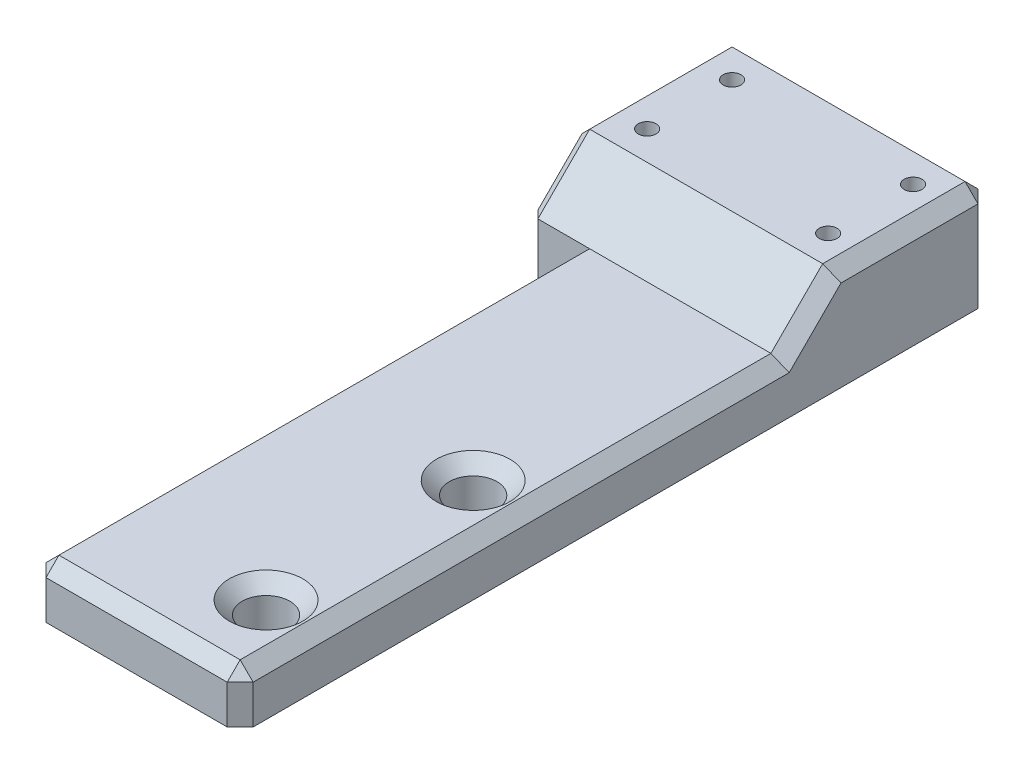
from build123d import *

# Parameters (mm, degrees)
SKETCH1_W           = 31.75
SKETCH1_H           = 92.075
SKETCH1_R           = 2.921
BOSS_EXTRUDE1_DEPTH = 12.7
SKETCH2_W           = 66.675
SKETCH2_H           = 6.35
CUT_EXTRUDE1_DEPTH  = 99.219947694
SKETCH3_R           = 1.0922
SKETCH3_W           = 6.35
SKETCH3_H           = 66.675
CUT_EXTRUDE2_DEPTH  = 99.219947694
CHAMFER1_SIZE       = 6.35
CHAMFER2_SIZE       = 1.5875


with BuildPart() as part:
    # Sketch1 → Boss-Extrude1 (new body)
    with BuildSketch(Plane(origin=(0, 0, 0), x_dir=(1, 0, 0), z_dir=(0, 1, 0))):
        with Locations((15.875, 46.0375)):
            Rectangle(SKETCH1_W, SKETCH1_H)
        with Locations((25.4, 9.525)):
            Circle(SKETCH1_R, mode=Mode.SUBTRACT)
        with Locations((25.4, 34.925)):
            Circle(SKETCH1_R, mode=Mode.SUBTRACT)
    extrude(amount=BOSS_EXTRUDE1_DEPTH)

    # Sketch2 → Cut-Extrude1 (cut, through all)
    with BuildSketch(Plane(origin=(31.75, 0, 0), x_dir=(0, 0, -1), z_dir=(1, 0, 0))):
        with Locations((33.3375, 9.525)):
            Rectangle(SKETCH2_W, SKETCH2_H)
    extrude(amount=-CUT_EXTRUDE1_DEPTH, mode=Mode.SUBTRACT)

    # Sketch3 → Cut-Extrude2 (cut, through all)
    with BuildSketch(Plane.XZ):
        with Locations((27.2796, -76.581)):
            Circle(SKETCH3_R)
        with Locations((5.08, -86.995)):
            Circle(SKETCH3_R)
        with Locations((27.2796, -86.995)):
            Circle(SKETCH3_R)
        with Locations((5.08, -76.581)):
            Circle(SKETCH3_R)
        with Locations((3.175, -33.3375)):
            Rectangle(SKETCH3_W, SKETCH3_H)
    extrude(amount=-CUT_EXTRUDE2_DEPTH, mode=Mode.SUBTRACT)

    # Chamfer1
    chamfer1_edges = [part.edges().sort_by_distance(p)[0] for p in [
        (15.875, 12.7, -66.675),
    ]]
    chamfer(chamfer1_edges, length=CHAMFER1_SIZE)

    # Chamfer2
    chamfer2_edges = [part.edges().sort_by_distance(p)[0] for p in [
        (22.479, 6.35, -9.525),
        (22.479, 6.35, -34.925),
        (31.75, 6.35, -92.075),
        (31.75, 3.175, 0),
        (6.35, 3.175, 0),
        (6.35, 6.35, -33.3375),
        (19.05, 6.35, 0),
        (31.75, 6.35, -33.3375),
        (31.75, 9.525, -69.85),
        (31.75, 12.7, -82.55),
        (0, 6.35, -92.075),
        (15.875, 12.7, -92.075),
        (0, 12.7, -82.55),
        (0, 9.525, -69.85),
        (0, 3.175, -66.675),
    ]]
    chamfer(chamfer2_edges, length=CHAMFER2_SIZE)


solid = part.part
